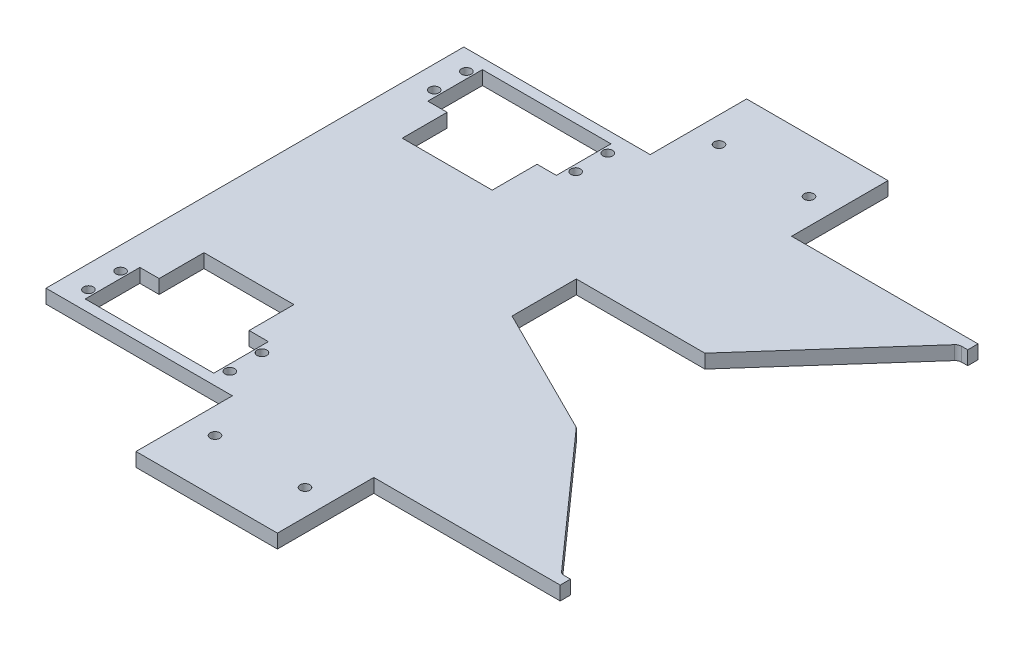
from build123d import *

# Parameters (mm, degrees)
BOSS_EXTRUDE1_DEPTH = 4.3
CUT_EXTRUDE1_DEPTH  = 4.5
FILLET1_R           = 2
CUT_EXTRUDE2_DEPTH  = 10
SKETCH8_R           = 1.5
CUT_EXTRUDE3_DEPTH  = 10
SKETCH9_R           = 1.5
CUT_EXTRUDE4_DEPTH  = 10


with BuildPart() as part:
    # Sketch2 → Boss-Extrude1 (new body)
    with BuildSketch(Plane(origin=(0, 0, 0), x_dir=(1, 0, 0), z_dir=(0, 1, 0))):
        Polygon((0, 0), (0, 65), (58, 65), (58, 95), (102, 95), (102, 65), (160, 65), (160, 0), align=None)
    extrude(amount=BOSS_EXTRUDE1_DEPTH)

    # Mirror1: part across plane


with BuildPart() as part_1:
    add(part.part)
    add(part.part.mirror(Plane(origin=(0, 4.3, 0), x_dir=(1, 0, 0), z_dir=(0, 0, -1))))

    # Sketch3 → Cut-Extrude1 (cut)
    with BuildSketch(Plane(origin=(0, 4.3, 0), x_dir=(1, 0, 0), z_dir=(0, 1, 0))):
        Polygon((160, -61.8), (160, 61.8), (157.156451185, 61.8), (120.012594795, 20), (80.012594795, 20), (80.012594795, 0), (120, -20), (157.155555556, -61.8), align=None)
    extrude(amount=-CUT_EXTRUDE1_DEPTH, mode=Mode.SUBTRACT)

    # Fillet1
    fillet1_edges = [part_1.edges().sort_by_distance(p)[0] for p in [
        (157.156451185, 2.15, -61.8),
        (157.155555556, 2.15, 61.8),
    ]]
    fillet(fillet1_edges, radius=FILLET1_R)

    # Sketch6 → Cut-Extrude2 (cut)
    with BuildSketch(Plane(origin=(0, 4.3, 0), x_dir=(1, 0, 0), z_dir=(0, 1, 0))):
        Polygon((9, -61.8), (49, -61.8), (49, -44.8), (43, -44.8), (43, -30.841820122), (15, -30.841820122), (15, -44.8), (9, -44.8), align=None)
        Polygon((9, 44.8), (15, 44.8), (15, 30.841820122), (43, 30.841820122), (43, 44.8), (49, 44.8), (49, 61.8), (9, 61.8), align=None)
    extrude(amount=-CUT_EXTRUDE2_DEPTH, mode=Mode.SUBTRACT)

    # Sketch8 → Cut-Extrude3 (cut)
    with BuildSketch(Plane(origin=(0, 4.3, 0), x_dir=(1, 0, 0), z_dir=(0, 1, 0))):
        with Locations((7, 58.8)):
            Circle(SKETCH8_R)
        with Locations((7, 48.8)):
            Circle(SKETCH8_R)
        with Locations((51, 48.8)):
            Circle(SKETCH8_R)
        with Locations((51, 58.8)):
            Circle(SKETCH8_R)
        with Locations((7, -48.8)):
            Circle(SKETCH8_R)
        with Locations((7, -58.8)):
            Circle(SKETCH8_R)
        with Locations((51, -58.8)):
            Circle(SKETCH8_R)
        with Locations((51, -48.8)):
            Circle(SKETCH8_R)
    extrude(amount=-CUT_EXTRUDE3_DEPTH, mode=Mode.SUBTRACT)

    # Sketch9 → Cut-Extrude4 (cut)
    with BuildSketch(Plane.XZ):
        with Locations((66, 78.4)):
            Circle(SKETCH9_R)
        with Locations((94, 78.4)):
            Circle(SKETCH9_R)
        with Locations((66, -78.4)):
            Circle(SKETCH9_R)
        with Locations((94, -78.4)):
            Circle(SKETCH9_R)
    extrude(amount=-CUT_EXTRUDE4_DEPTH, mode=Mode.SUBTRACT)


solid = part_1.part
